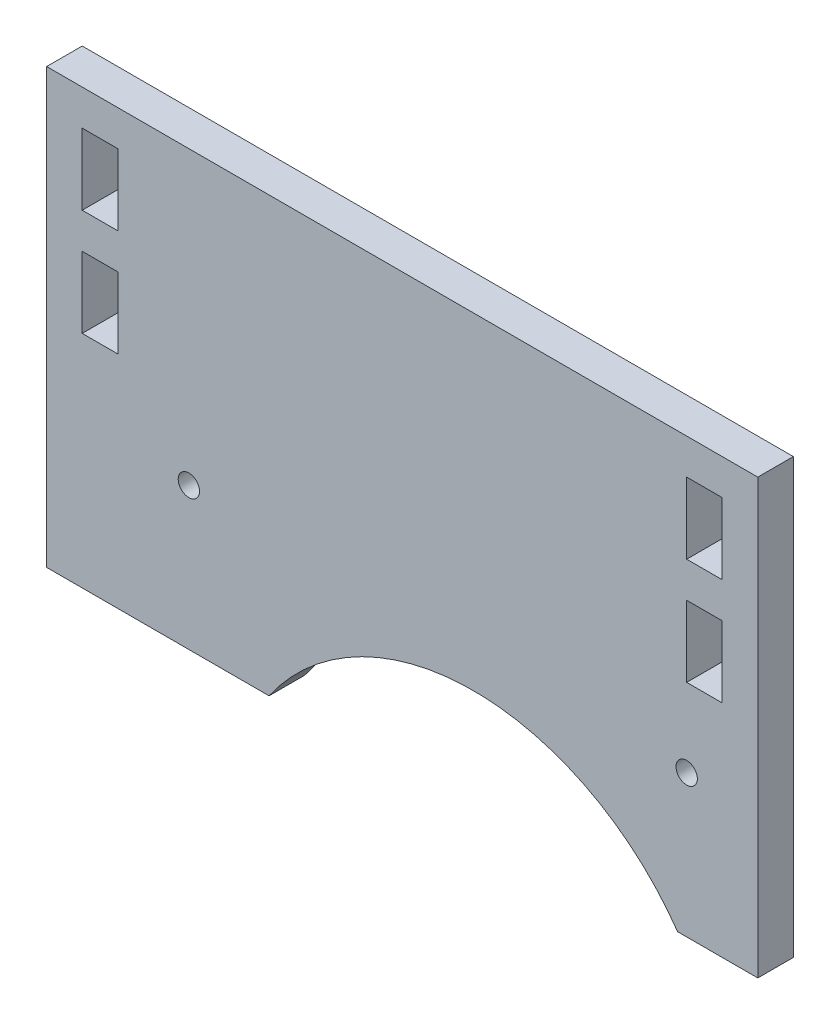
from build123d import *

# Parameters (mm, degrees)
ESQUISSE1_R        = 1.5
ESQUISSE1_W        = 5
ESQUISSE1_H        = 10
BOSS_EXTRU_1_DEPTH = 5


with BuildPart() as part:
    # Esquisse1 → Boss.-Extru.1 (new body)
    with BuildSketch(Plane.XY):
        with BuildLine():
            Line((0, 0), (31.277186767, 0))
            ThreePointArc((31.277186767, 0), (60, 15), (88.722813233, 0))
            Line((88.722813233, 0), (100, 0))
            Line((100, 0), (100, 61))
            Line((100, 61), (0, 61))
            Line((0, 61), (0, 0))
        make_face()
        with Locations((20, 20)):
            Circle(ESQUISSE1_R, mode=Mode.SUBTRACT)
        with Locations((90, 20)):
            Circle(ESQUISSE1_R, mode=Mode.SUBTRACT)
        with Locations((92.5, 51)):
            Rectangle(ESQUISSE1_W, ESQUISSE1_H, mode=Mode.SUBTRACT)
        with Locations((92.5, 36)):
            Rectangle(ESQUISSE1_W, ESQUISSE1_H, mode=Mode.SUBTRACT)
        with Locations((7.5, 51)):
            Rectangle(ESQUISSE1_W, ESQUISSE1_H, mode=Mode.SUBTRACT)
        with Locations((7.5, 36)):
            Rectangle(ESQUISSE1_W, ESQUISSE1_H, mode=Mode.SUBTRACT)
    extrude(amount=BOSS_EXTRU_1_DEPTH)


solid = part.part
